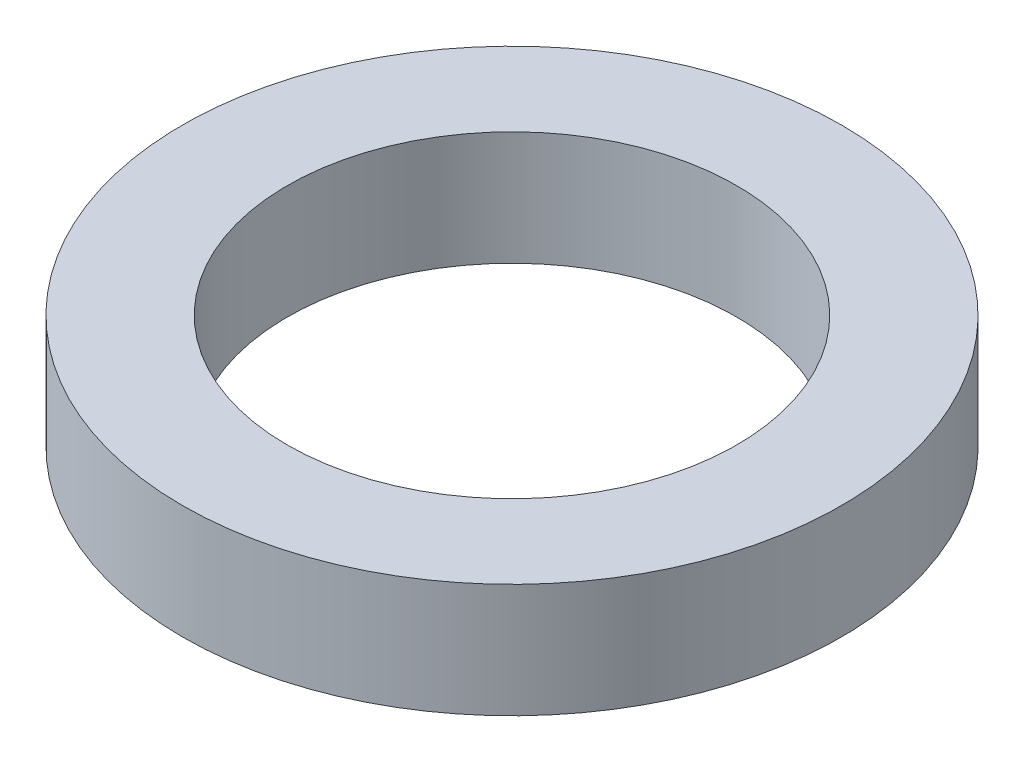
from build123d import *

# Parameters (mm, degrees)
SKETCH1_R           = 55
BOSS_EXTRUDE1_DEPTH = 19
SKETCH2_R           = 37.5
CUT_EXTRUDE1_DEPTH  = 81.068720484


with BuildPart() as part:
    # Sketch1 → Boss-Extrude1 (new body)
    with BuildSketch(Plane(origin=(0, 0, 0), x_dir=(1, 0, 0), z_dir=(0, 1, 0))):
        Circle(SKETCH1_R)
    extrude(amount=BOSS_EXTRUDE1_DEPTH)

    # Sketch2 → Cut-Extrude1 (cut, through all)
    with BuildSketch(Plane(origin=(0, 0, 0), x_dir=(1, 0, 0), z_dir=(0, 1, 0))):
        Circle(SKETCH2_R)
    extrude(amount=CUT_EXTRUDE1_DEPTH, mode=Mode.SUBTRACT)


solid = part.part
